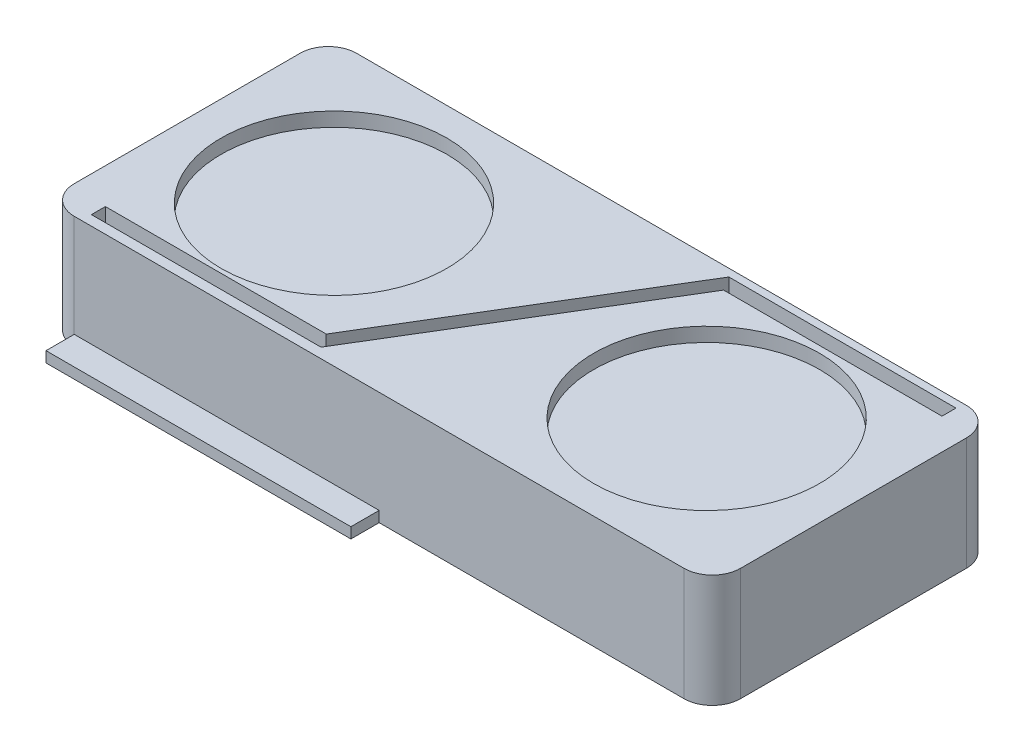
from build123d import *

# Parameters (mm, degrees)
SKETCH1_W           = 236
SKETCH1_H           = 100
BOSS_EXTRUDE1_DEPTH = 40
SKETCH2_R           = 40
CUT_EXTRUDE1_DEPTH  = 5
FILLET1_R           = 10
CUT_EXTRUDE2_DEPTH  = 10
SKETCH4_W           = 108
SKETCH4_H           = 3.774903877
BOSS_EXTRUDE2_DEPTH = 10


with BuildPart() as part:
    # Sketch1 → Boss-Extrude1 (new body)
    with BuildSketch(Plane(origin=(0, 0, 0), x_dir=(1, 0, 0), z_dir=(0, 1, 0))):
        Rectangle(SKETCH1_W, SKETCH1_H)
    extrude(amount=BOSS_EXTRUDE1_DEPTH)

    # Sketch2 → Cut-Extrude1 (cut)
    with BuildSketch(Plane(origin=(0, 40, 0), x_dir=(1, 0, 0), z_dir=(0, 1, 0))):
        with Locations((-66, 0)):
            Circle(SKETCH2_R)
        with Locations((66, 0)):
            Circle(SKETCH2_R)
    extrude(amount=-CUT_EXTRUDE1_DEPTH, mode=Mode.SUBTRACT)

    # Fillet1
    fillet1_edges = [part.edges().sort_by_distance(p)[0] for p in [
        (118, 20, 50),
        (118, 20, -50),
        (-118, 20, 50),
        (-118, 20, -50),
    ]]
    fillet(fillet1_edges, radius=FILLET1_R)

    # Sketch3 → Cut-Extrude2 (cut)
    with BuildSketch(Plane(origin=(0, 40, 0), x_dir=(1, 0, 0), z_dir=(0, 1, 0))):
        Polygon((-105.463124796, -41.502087977), (-105.463124796, -46.455012056), (-24.138936023, -46.455012056), (29.66006691, 42.356040404), (107.000239166, 42.356040404), (107.000239166, 47.308964484), (26.557920495, 47.308964484), (-27.241082437, -41.502087977), align=None)
    extrude(amount=-CUT_EXTRUDE2_DEPTH, mode=Mode.SUBTRACT)

    # Sketch4 → Boss-Extrude2 (add)
    with BuildSketch(Plane.XY.offset(50)):
        with Locations((-54, 1.887451939)):
            Rectangle(SKETCH4_W, SKETCH4_H)
    extrude(amount=BOSS_EXTRUDE2_DEPTH)


solid = part.part
